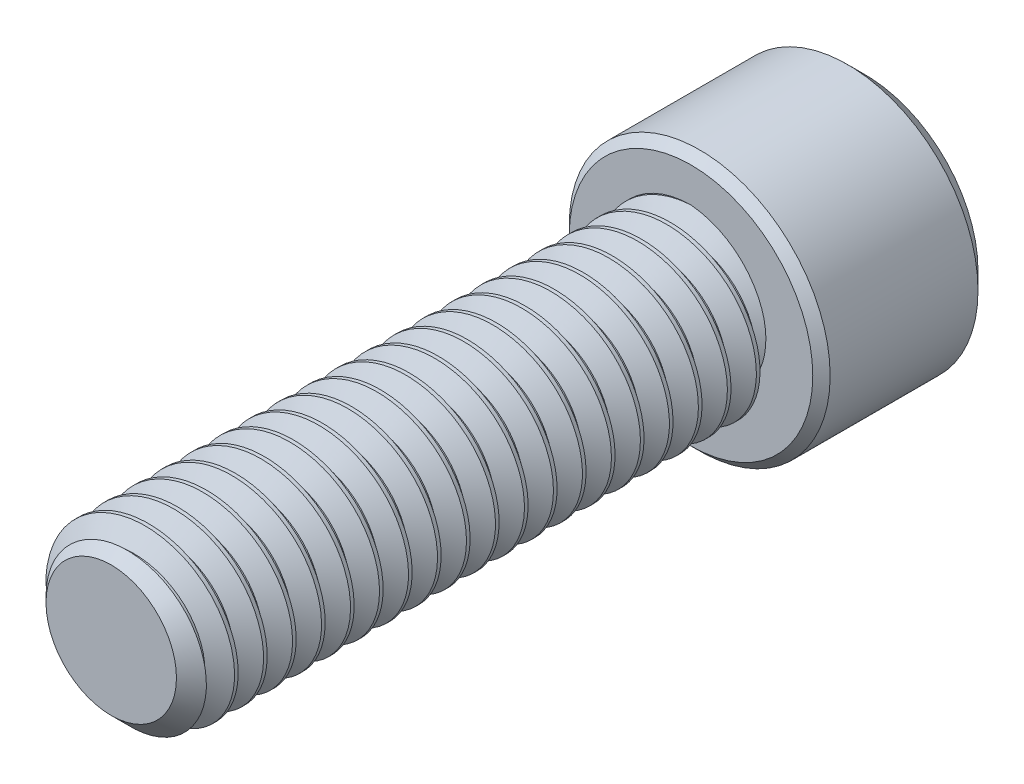
from build123d import *

# Parameters (mm, degrees)
SKETCH1_R          = 4.7625
EXTRUDE1_DEPTH     = 31.75
CHAMFER3_SIZE      = 1.190625
CUT_SWEEP1_PITCH   = 1.5875
SKETCH6_R          = 7.14375
EXTRUDE2_DEPTH     = 9.525
CUT_EXTRUDE1_DEPTH = 5.953125
SKETCH8_R          = 4.582717762
CUT_EXTRUDE2_DEPTH = 0.9525
CUT_EXTRUDE2_DRAFT = -45
CHAMFER1_SIZE      = 0.9525
CHAMFER2_SIZE      = 0.47625


with BuildPart() as part:
    # Sketch1 → Extrude1 (new body)
    with BuildSketch(Plane.XY):
        Circle(SKETCH1_R)
    extrude(amount=-EXTRUDE1_DEPTH)

    # Chamfer3
    chamfer3_edges = [part.edges().sort_by_distance(p)[0] for p in [
        (-4.7625, 0, 0),
    ]]
    chamfer(chamfer3_edges, length=CHAMFER3_SIZE)

    # Cut-Sweep1: the profile of Sketch3 profile screwed along a right-hand helix of 21 turns, 6 arcs to a turn; built about Z, then put on its axis
    cut_sweep1_z = Axis((0, 0, 0), (0, 0, 1))
    cut_sweep1_corners = [(4.7628, 0, -1.389235705), (3.731388504, 0, -0.79375), (3.731388504, 0, -0.5953125), (4.7628, 0, 0.000173205)]
    with BuildLine(mode=Mode.PRIVATE) as cut_sweep1_profile:
        Line(cut_sweep1_corners[0], cut_sweep1_corners[1])
        Line(cut_sweep1_corners[1], cut_sweep1_corners[2])
        Line(cut_sweep1_corners[2], cut_sweep1_corners[3])
        Line(cut_sweep1_corners[3], cut_sweep1_corners[0])
    cut_sweep1_cap = Face(cut_sweep1_profile.wire())
    cut_sweep1_turn_angles = [0, 30, 60, 90, 120, 150, 180, 210, 240, 270, 300, 330, 360]
    cut_sweep1_turn_weights = [1, 0.8660254037844387, 1, 0.8660254037844387, 1, 0.8660254037844387, 1, 0.8660254037844387, 1, 0.8660254037844387, 1, 0.8660254037844387, 1]
    cut_sweep1_turn_rails = [Edge.make_bspline([Vector(p[0], p[1], 0).rotate(cut_sweep1_z, cut_sweep1_turn_angles[k]) / cut_sweep1_turn_weights[k] + Vector(0, 0, p[2] + CUT_SWEEP1_PITCH * cut_sweep1_turn_angles[k] / 360) for k in range(13)], [0, 0, 0, 1, 1, 2, 2, 3, 3, 4, 4, 5, 5, 6, 6, 6], 2, cut_sweep1_turn_weights) for p in cut_sweep1_corners]
    cut_sweep1_turn_sides = [Face.make_surface_from_curves(cut_sweep1_turn_rails[p[0]], cut_sweep1_turn_rails[p[1]]) for p in [(0, 1), (1, 2), (2, 3), (3, 0)]]
    cut_sweep1 = Plane(origin=(0, 0, 0), x_dir=(0, 1, 0), z_dir=(0, 0, -1)) * Solid(Shell([*[p.moved(Location((0, 0, CUT_SWEEP1_PITCH * i))) for i in range(21) for p in cut_sweep1_turn_sides], cut_sweep1_cap, cut_sweep1_cap.rotate(cut_sweep1_z, 7560).moved(Location((0, 0, CUT_SWEEP1_PITCH * 7560 / 360)))]))
    add(cut_sweep1, mode=Mode.SUBTRACT)

    # Sketch6 → Extrude2 (add)
    with BuildSketch(Plane(origin=(0, 0, -31.75), x_dir=(-1, 0, 0), z_dir=(0, 0, -1))):
        with Locations(Location((0, 0, 0), (0, 0, 180))):
            Circle(SKETCH6_R)
    extrude(amount=EXTRUDE2_DEPTH)

    # Sketch7 → Cut-Extrude1 (cut)
    with BuildSketch(Plane(origin=(0, 0, -41.275), x_dir=(-1, 0, 0), z_dir=(0, 0, -1))):
        Polygon((0, 4.582717762), (-3.96875, 2.291358881), (-3.96875, -2.291358881), (0, -4.582717762), (3.96875, -2.291358881), (3.96875, 2.291358881), align=None)
    extrude(amount=-CUT_EXTRUDE1_DEPTH, mode=Mode.SUBTRACT)


with BuildPart() as cut_extrude2_tool:
    # Sketch8 → Cut-Extrude2 (with draft: the straight prism first)
    with BuildSketch(Plane(origin=(0, 0, -41.275), x_dir=(-1, 0, 0), z_dir=(0, 0, -1))):
        Circle(SKETCH8_R)
    extrude(amount=-CUT_EXTRUDE2_DEPTH)
    # Cut-Extrude2: the draft: its side faces are tilted about the plane it starts from
    cut_extrude2_sides = [cut_extrude2_tool.faces().sort_by_distance(p)[0] for p in [
        (4.582717762, 0, -40.79875),
    ]]
    draft(cut_extrude2_sides, Plane(origin=(0, 0, -41.275), x_dir=(-1, 0, 0), z_dir=(0, 0, -1)), CUT_EXTRUDE2_DRAFT)


with BuildPart() as part_1:
    add(part.part)

    # Cut-Extrude2: cut by cut_extrude2_tool
    add(cut_extrude2_tool.part, mode=Mode.SUBTRACT)

    # Chamfer1
    chamfer1_edges = [part_1.edges().sort_by_distance(p)[0] for p in [
        (-7.14375, 0, -41.275),
    ]]
    chamfer(chamfer1_edges, length=CHAMFER1_SIZE)

    # Chamfer2
    chamfer2_edges = [part_1.edges().sort_by_distance(p)[0] for p in [
        (-7.14375, 0, -31.75),
    ]]
    chamfer(chamfer2_edges, length=CHAMFER2_SIZE)


solid = part_1.part
